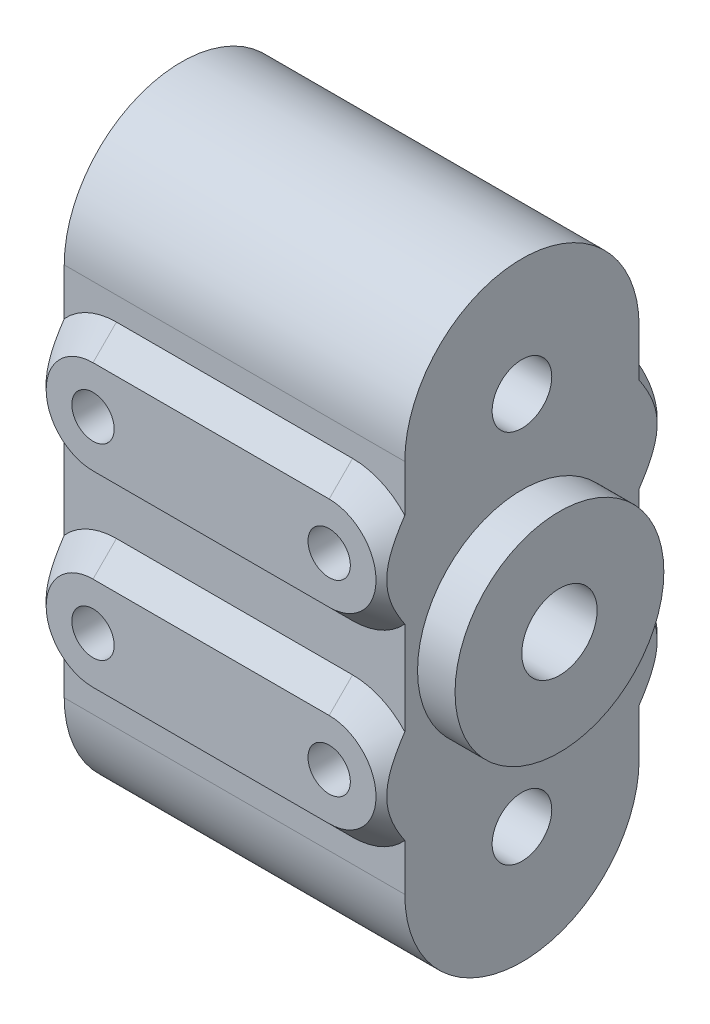
from build123d import *

# Parameters (mm, degrees)
BOSS_EXTRUDE1_DEPTH                      = 23.075011
SKETCH8_R                                = 7.0739
BOSS_EXTRUDE2_DEPTH                      = 2.54
F_1_4_20_TAPPED_HOLE1_D                  = 5.1054
F_10_32_TAPPED_HOLE1_D                   = 4.0386
BOSS_EXTRUDE3_DEPTH                      = 2.54
BOSS_EXTRUDE3_DRAFT                      = 45
MIRROR1_COPY_1_DEPTH                     = 2.54
MIRROR1_COPY_1_DRAFT                     = 45
MIRROR1_AT_THE_SECOND_PLANE_COPY_1_DEPTH = 2.54
MIRROR1_AT_THE_SECOND_PLANE_COPY_1_DRAFT = 45
MIRROR1_AT_THE_SECOND_PLANE_COPY_2_DEPTH = 2.54
MIRROR1_AT_THE_SECOND_PLANE_COPY_2_DRAFT = 45
SKETCH14_W                               = 19.05
SKETCH14_H                               = 41.275
CUT_EXTRUDE1_DEPTH                       = 35.245595626
SKETCH15_W                               = 19.05
SKETCH15_H                               = 41.275
SKETCH15_R                               = 7.0739
CUT_EXTRUDE2_DEPTH                       = 33.3896305
F_6_40_TAPPED_HOLE1_D                    = 2.8702
F_13_64_0_20313_DIAMETER_HOLE1_D         = 5.159502
F_13_64_0_20313_DIAMETER_HOLE1_DEPTH     = 3.175
F_13_64_0_20313_DIAMETER_HOLE1_TIP       = 1.550070783


with BuildPart() as part:
    # Sketch1 → Boss-Extrude1 (new body)
    with BuildSketch(Plane(origin=(0, 0, 0), x_dir=(0, 0, -1), z_dir=(1, 0, 0))):
        with BuildLine():
            Line((7.9375, 12.7), (7.9375, -12.7))
            ThreePointArc((7.9375, -12.7), (0, -20.6375), (-7.9375, -12.7))
            Line((-7.9375, -12.7), (-7.9375, 12.7))
            ThreePointArc((-7.9375, 12.7), (0, 20.6375), (7.9375, 12.7))
        make_face()
    extrude(amount=BOSS_EXTRUDE1_DEPTH)

    # Sketch8 → Boss-Extrude2 (add)
    with BuildSketch(Plane(origin=(23.075011, 0, 0), x_dir=(0, 0, -1), z_dir=(1, 0, 0))):
        Circle(SKETCH8_R)
    extrude(amount=BOSS_EXTRUDE2_DEPTH)

    # 1/4-20 Tapped Hole1 (through all)
    with Locations(Plane(origin=(25.615011, 0, 0), x_dir=(0, 0, -1), z_dir=(1, 0, 0))):
        with Locations((0, 0)):
            Hole(F_1_4_20_TAPPED_HOLE1_D / 2)

    # #10-32 Tapped Hole1 (through all)
    with Locations(Plane(origin=(23.075011, 0, 0), x_dir=(0, 0, -1), z_dir=(1, 0, 0))):
        with Locations((0, 12.7), (0, -12.7)):
            Hole(F_10_32_TAPPED_HOLE1_D / 2)


with BuildPart() as boss_extrude3_tool:
    # Sketch13 → Boss-Extrude3 (with draft: the straight prism first)
    with BuildSketch(Plane.XY.offset(9.525)):
        with BuildLine():
            ThreePointArc((3.5375055, 9.525), (0.3625055, 6.35), (3.5375055, 3.175))
            Line((3.5375055, 3.175), (19.5375055, 3.175))
            ThreePointArc((19.5375055, 3.175), (22.7125055, 6.35), (19.5375055, 9.525))
            Line((19.5375055, 9.525), (3.5375055, 9.525))
        make_face()
    extrude(amount=-BOSS_EXTRUDE3_DEPTH)
    # Boss-Extrude3: the draft: its side faces are tilted about the plane it starts from
    boss_extrude3_sides = [boss_extrude3_tool.faces().sort_by_distance(p)[0] for p in [
        (11.5375055, 3.175, 8.255),
        (22.7125055, 6.35, 8.255),
        (11.5375055, 9.525, 8.255),
        (0.3625055, 6.35, 8.255),
    ]]
    draft(boss_extrude3_sides, Plane.XY.offset(9.525), BOSS_EXTRUDE3_DRAFT)


with BuildPart() as part_1:
    add(part.part)

    # Boss-Extrude3: add boss_extrude3_tool
    add(boss_extrude3_tool.part)


with BuildPart() as mirror1_copy_1_tool:
    # Mirror1 copy 1 sketch → Mirror1 copy 1 (with draft: the straight prism first)
    with BuildSketch(Plane.XY.offset(9.525)):
        with BuildLine():
            ThreePointArc((3.5375055, -9.525), (0.3625055, -6.35), (3.5375055, -3.175))
            Line((3.5375055, -3.175), (19.5375055, -3.175))
            ThreePointArc((19.5375055, -3.175), (22.7125055, -6.35), (19.5375055, -9.525))
            Line((19.5375055, -9.525), (3.5375055, -9.525))
        make_face()
    extrude(amount=-MIRROR1_COPY_1_DEPTH)
    # Mirror1 copy 1: the draft: its side faces are tilted about the plane it starts from
    mirror1_copy_1_sides = [mirror1_copy_1_tool.faces().sort_by_distance(p)[0] for p in [
        (11.5375055, -3.175, 8.255),
        (22.7125055, -6.35, 8.255),
        (11.5375055, -9.525, 8.255),
        (0.3625055, -6.35, 8.255),
    ]]
    draft(mirror1_copy_1_sides, Plane.XY.offset(9.525), MIRROR1_COPY_1_DRAFT)


with BuildPart() as part_2:
    add(part_1.part)

    # Mirror1 copy 1: add mirror1_copy_1_tool
    add(mirror1_copy_1_tool.part)


with BuildPart() as mirror1_at_the_second_plane_copy_1_tool:
    # Mirror1 at the second plane copy 1 sketc → Mirror1 at the second plane copy 1 (with draft: the straight prism first)
    with BuildSketch(Plane(origin=(0, 0, -9.525), x_dir=(1, 0, 0), z_dir=(0, 0, -1))):
        with BuildLine():
            ThreePointArc((3.5375055, -9.525), (0.3625055, -6.35), (3.5375055, -3.175))
            Line((3.5375055, -3.175), (19.5375055, -3.175))
            ThreePointArc((19.5375055, -3.175), (22.7125055, -6.35), (19.5375055, -9.525))
            Line((19.5375055, -9.525), (3.5375055, -9.525))
        make_face()
    extrude(amount=-MIRROR1_AT_THE_SECOND_PLANE_COPY_1_DEPTH)
    # Mirror1 at the second plane copy 1: the draft: its side faces are tilted about the plane it starts from
    mirror1_at_the_second_plane_copy_1_sides = [mirror1_at_the_second_plane_copy_1_tool.faces().sort_by_distance(p)[0] for p in [
        (11.5375055, 3.175, -8.255),
        (22.7125055, 6.35, -8.255),
        (11.5375055, 9.525, -8.255),
        (0.3625055, 6.35, -8.255),
    ]]
    draft(mirror1_at_the_second_plane_copy_1_sides, Plane(origin=(0, 0, -9.525), x_dir=(1, 0, 0), z_dir=(0, 0, -1)), MIRROR1_AT_THE_SECOND_PLANE_COPY_1_DRAFT)


with BuildPart() as part_3:
    add(part_2.part)

    # Mirror1 at the second plane copy 1: add mirror1_at_the_second_plane_copy_1_tool
    add(mirror1_at_the_second_plane_copy_1_tool.part)


with BuildPart() as mirror1_at_the_second_plane_copy_2_tool:
    # Mirror1 at the second plane copy 2 sketc → Mirror1 at the second plane copy 2 (with draft: the straight prism first)
    with BuildSketch(Plane(origin=(0, 0, -9.525), x_dir=(1, 0, 0), z_dir=(0, 0, -1))):
        with BuildLine():
            ThreePointArc((3.5375055, 9.525), (0.3625055, 6.35), (3.5375055, 3.175))
            Line((3.5375055, 3.175), (19.5375055, 3.175))
            ThreePointArc((19.5375055, 3.175), (22.7125055, 6.35), (19.5375055, 9.525))
            Line((19.5375055, 9.525), (3.5375055, 9.525))
        make_face()
    extrude(amount=-MIRROR1_AT_THE_SECOND_PLANE_COPY_2_DEPTH)
    # Mirror1 at the second plane copy 2: the draft: its side faces are tilted about the plane it starts from
    mirror1_at_the_second_plane_copy_2_sides = [mirror1_at_the_second_plane_copy_2_tool.faces().sort_by_distance(p)[0] for p in [
        (11.5375055, -3.175, -8.255),
        (22.7125055, -6.35, -8.255),
        (11.5375055, -9.525, -8.255),
        (0.3625055, -6.35, -8.255),
    ]]
    draft(mirror1_at_the_second_plane_copy_2_sides, Plane(origin=(0, 0, -9.525), x_dir=(1, 0, 0), z_dir=(0, 0, -1)), MIRROR1_AT_THE_SECOND_PLANE_COPY_2_DRAFT)


with BuildPart() as part_4:
    add(part_3.part)

    # Mirror1 at the second plane copy 2: add mirror1_at_the_second_plane_copy_2_tool
    add(mirror1_at_the_second_plane_copy_2_tool.part)

    # Sketch14 → Cut-Extrude1 (cut, through all)
    with BuildSketch(Plane.ZY):
        Rectangle(SKETCH14_W, SKETCH14_H)
    extrude(amount=CUT_EXTRUDE1_DEPTH, mode=Mode.SUBTRACT)

    # Sketch15 → Cut-Extrude2 (cut, through all)
    with BuildSketch(Plane(origin=(23.075011, 0, 0), x_dir=(0, 0, -1), z_dir=(1, 0, 0))):
        Rectangle(SKETCH15_W, SKETCH15_H)
        Circle(SKETCH15_R, mode=Mode.SUBTRACT)
    extrude(amount=CUT_EXTRUDE2_DEPTH, mode=Mode.SUBTRACT)

    # #6-40 Tapped Hole1 (through all)
    with Locations(Plane.XY.offset(9.525)):
        with Locations((3.5375055, 6.35), (19.5375055, 6.35), (3.5375055, -6.35), (19.5375055, -6.35)):
            Hole(F_6_40_TAPPED_HOLE1_D / 2)

    # 13/64 (0.20313) Diameter Hole1
    with Locations(Plane.ZY):
        with Locations((0, -12.7), (0, 12.7)):
            Hole(F_13_64_0_20313_DIAMETER_HOLE1_D / 2, depth=F_13_64_0_20313_DIAMETER_HOLE1_DEPTH)
            with Locations((0, 0, -(F_13_64_0_20313_DIAMETER_HOLE1_DEPTH + F_13_64_0_20313_DIAMETER_HOLE1_TIP / 2))):  # 118° drill point
                Cone(0, F_13_64_0_20313_DIAMETER_HOLE1_D / 2, F_13_64_0_20313_DIAMETER_HOLE1_TIP, mode=Mode.SUBTRACT)


solid = part_4.part
